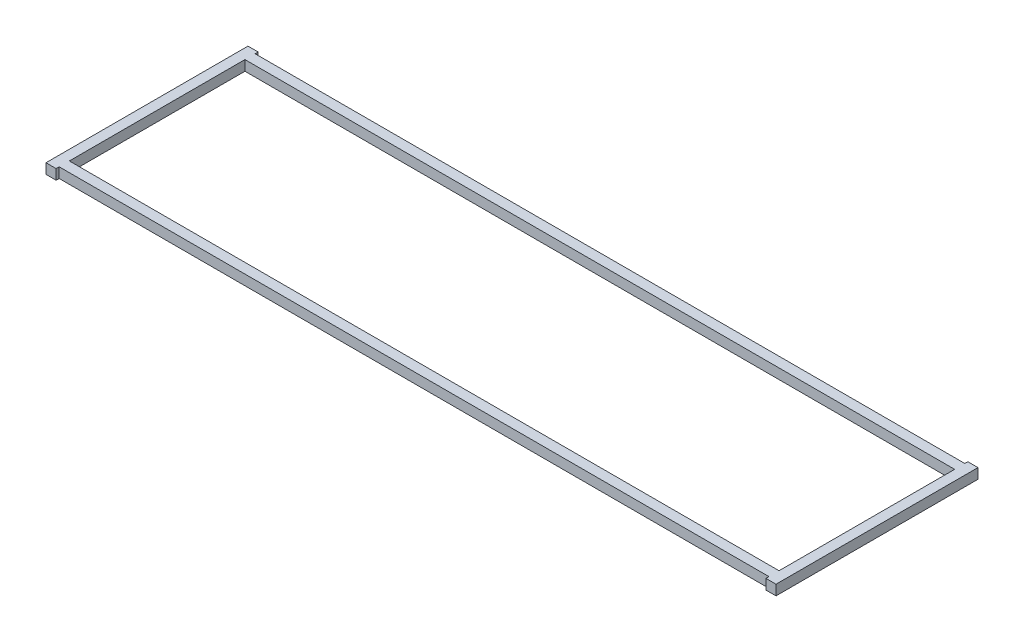
from build123d import *

# Parameters (mm, degrees)
SKETCH1_W           = 444.5
SKETCH1_H           = 109.98835
BOSS_EXTRUDE1_DEPTH = 6.35


with BuildPart() as part:
    # Sketch1 → Boss-Extrude1 (new body)
    with BuildSketch(Plane(origin=(0, 0, 0), x_dir=(1, 0, 0), z_dir=(0, 1, 0))):
        Polygon((222.25, 63.25235), (228.6, 63.25235), (228.6, -63.25235), (222.25, -63.25235), (222.25, -61.344175), (-222.25, -61.344175), (-222.25, -63.25235), (-228.6, -63.25235), (-228.6, 63.25235), (-222.25, 63.25235), (-222.25, 61.344175), (222.25, 61.344175), align=None)
        Rectangle(SKETCH1_W, SKETCH1_H, mode=Mode.SUBTRACT)
    extrude(amount=BOSS_EXTRUDE1_DEPTH)


solid = part.part
